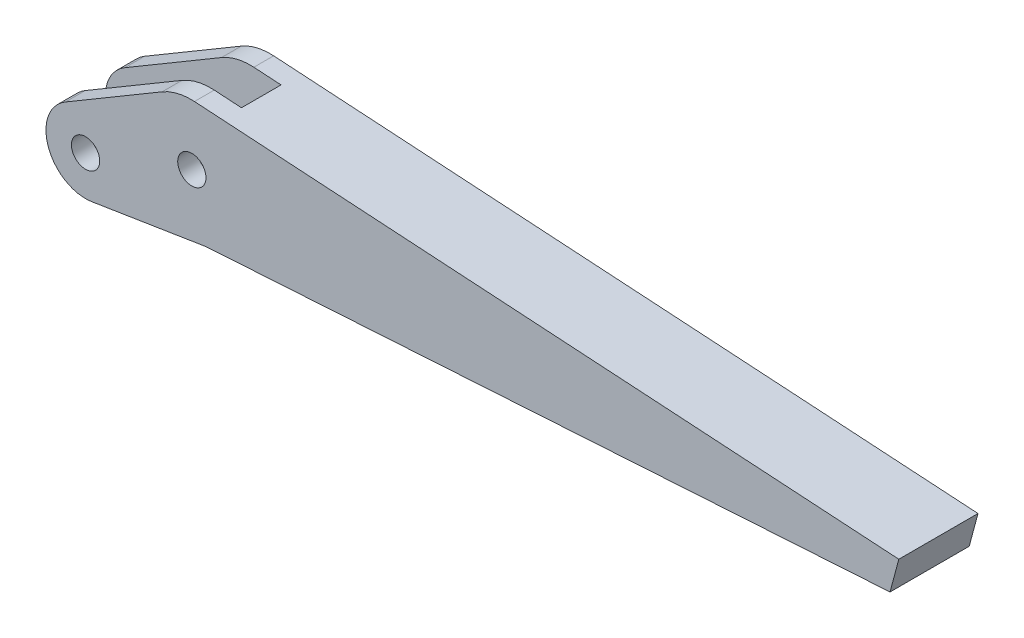
from build123d import *

# Parameters (mm, degrees)
SKETCH1_R               = 1.25
BOSS_EXTRUDE1_DEPTH     = 7
CUT_EXTRUDE1_DEPTH      = 63.812268863
CUT_EXTRUDE1_DEPTH_BACK = 63.812268863
SKETCH2_W               = 32.592394384
SKETCH2_H               = 3.5
FILLET1_R               = 5


with BuildPart() as part:
    # Sketch1 → Boss-Extrude1 (new body)
    with BuildSketch(Plane.XY):
        with BuildLine():
            Line((61.721813599, -1.473254022), (1.264188363, -5.267583503))
            Line((1.264188363, -5.267583503), (-8.846841125, -6.87670348))
            ThreePointArc((-8.846841125, -6.87670348), (-12.689755312, -4.606488283), (-11.177624454, -0.407044658))
            Line((-11.177624454, -0.407044658), (-1.302853294, 5.428691416))
            Line((-1.302853294, 5.428691416), (62.498270735, 1.424523457))
            Line((62.498270735, 1.424523457), (61.721813599, -1.473254022))
        make_face()
        Circle(SKETCH1_R, mode=Mode.SUBTRACT)
        with Locations((-9.396926208, -3.420201433)):
            Circle(SKETCH1_R, mode=Mode.SUBTRACT)
    extrude(amount=BOSS_EXTRUDE1_DEPTH)

    # Sketch2 → Cut-Extrude1 (cut, two sides: drawn at the far end of the back side and taken through both)
    with BuildSketch(Plane(origin=(0.427525179, -1.174615776, 0), x_dir=(0.9396926207859082, 0.3420201433256693, 0), z_dir=(-0.3420201433256693, 0.9396926207859082, 0)).offset(-CUT_EXTRUDE1_DEPTH_BACK)):
        with Locations((-12.046197192, -3.5)):
            Rectangle(SKETCH2_W, SKETCH2_H)
    extrude(amount=CUT_EXTRUDE1_DEPTH + CUT_EXTRUDE1_DEPTH_BACK, mode=Mode.SUBTRACT)

    # Fillet1
    # the kernel refuses this fillet: 5 mm, written as the material it adds along each edge
    with BuildSketch(Plane(origin=(1.264188363, -5.267583503, 5.25), x_dir=(0.9980363808193768, 0.06263691053172936, 0), z_dir=(0, 0, 1)), Plane(origin=(1.264188363, -5.267583503, 0), x_dir=(0.9980363808193768, 0.06263691053172936, 0), z_dir=(0, 0, 1))) as fillet1_piece_1:
        with BuildLine():
            CenterArc((FILLET1_R * 0.0476077036938, -FILLET1_R), FILLET1_R, 90, 5.45132501)
            Line((-FILLET1_R * 0.0473923866113, -FILLET1_R * 0.00452273615014), (0, 0))
            Line((0, 0), (FILLET1_R * 0.0476077036938, 0))
        make_face()
    extrude(amount=1.75)
    # the kernel refuses this fillet: 5 mm, written as the material it takes off along each edge
    with BuildSketch(Plane(origin=(-1.302853294, 5.428691416, 1.407700386), x_dir=(0.9980363808193763, -0.06263691053173732, 0), z_dir=(0, 0, 1))) as fillet1_2_piece_1:
        with BuildLine():
            CenterArc((FILLET1_R * 0.3073839691, -FILLET1_R), FILLET1_R, 90, 34.173177968)
            Line((-FILLET1_R * 0.254312163661, -FILLET1_R * 0.172656386716), (0, 0))
            Line((0, 0), (FILLET1_R * 0.3073839691, 0))
        make_face()
    extrude(amount=9.434599227, mode=Mode.SUBTRACT)
    with BuildSketch(Plane(origin=(-1.302853294, 5.428691416, -3.842299614), x_dir=(-0.8609019359097801, -0.5087709275762453, 0), z_dir=(0, 0, 1))) as fillet1_2_piece_2:
        with BuildLine():
            CenterArc((FILLET1_R * 0.3073839691, FILLET1_R), FILLET1_R, 235.826822032, 34.173177968)
            Line((-FILLET1_R * 0.254312163661, FILLET1_R * 0.172656386716), (0, 0))
            Line((0, 0), (FILLET1_R * 0.3073839691, 0))
        make_face()
    extrude(amount=9.434599227, mode=Mode.SUBTRACT)


solid = part.part
